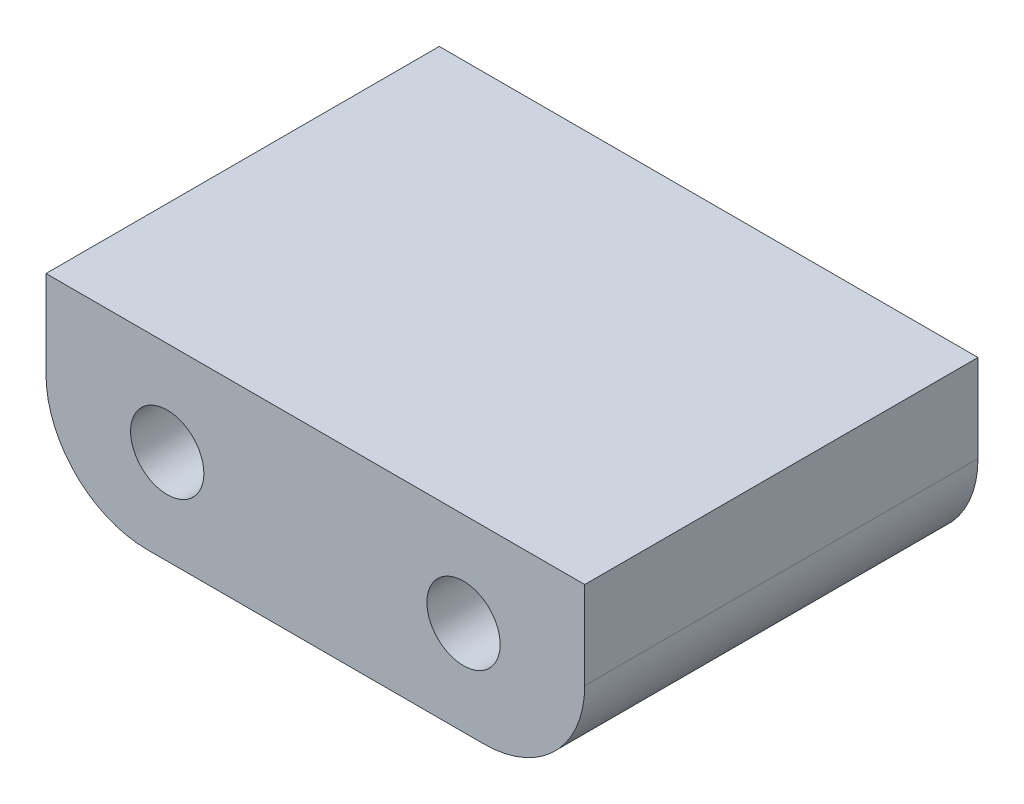
from build123d import *

# Parameters (mm, degrees)
SKETCH1_W                 = 25.4
SKETCH1_H                 = 18.542
BOSS_EXTRUDE1_DEPTH       = 4.445
TAP_DRILL_FOR_8_32_TAP1_D = 3.4544
FILLET1_R                 = 4.7625


with BuildPart() as part:
    # Sketch1 → Boss-Extrude1 (new, symmetric)
    with BuildSketch(Plane(origin=(0, 0, 0), x_dir=(1, 0, 0), z_dir=(0, 1, 0))):
        Rectangle(SKETCH1_W, SKETCH1_H)
    extrude(amount=BOSS_EXTRUDE1_DEPTH, both=True)

    # Tap Drill for #8-32 Tap1 (through all)
    with Locations(Plane.XY.offset(9.271)):
        with Locations((-6.985, 0), (6.985, 0)):
            Hole(TAP_DRILL_FOR_8_32_TAP1_D / 2)

    # Fillet1
    fillet1_edges = [part.edges().sort_by_distance(p)[0] for p in [
        (12.7, -4.445, 0),
        (-12.7, -4.445, 0),
    ]]
    fillet(fillet1_edges, radius=FILLET1_R)


solid = part.part
